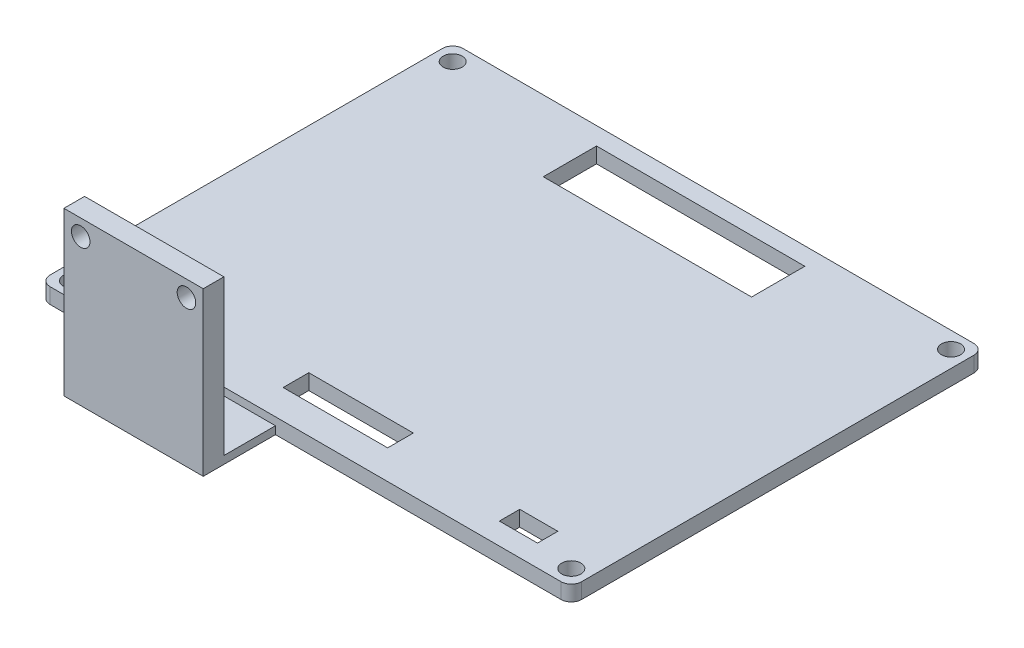
from build123d import *

# Parameters (mm, degrees)
SKETCH_1_R          = 1.85
SKETCH_1_W          = 7.387531562
SKETCH_1_H          = 3.94976935
SKETCH_1_W_2        = 20.26085389
SKETCH_1_H_2        = 4.973783626
SKETCH_1_W_3        = 40.374860346
SKETCH_1_H_3        = 10.321291022
EXTRUDE_1_DEPTH     = 3
SKETCH_2_W          = 27
SKETCH_2_H          = 1.5
EXTRUDE_2_DEPTH     = 14
SKETCH_4_W          = 27
SKETCH_4_H          = 4
EXTRUDE_3_DEPTH     = 30
SKETCH_5_R          = 1.8
CUT_EXTRUDE_1_DEPTH = 30


with BuildPart() as part:
    # 草图1 → 凸台-拉伸1 (new body)
    with BuildSketch(Plane(origin=(0, 0, 0), x_dir=(1, 0, 0), z_dir=(0, 1, 0))):
        with BuildLine():
            Line((-49.5, -40), (49.5, -40))
            ThreePointArc((49.5, -40), (50.914213562, -39.414213562), (51.5, -38))
            Line((51.5, -38), (51.5, 38))
            ThreePointArc((51.5, 38), (50.914213562, 39.414213562), (49.5, 40))
            Line((49.5, 40), (-49.5, 40))
            ThreePointArc((-49.5, 40), (-50.914213562, 39.414213562), (-51.5, 38))
            Line((-51.5, 38), (-51.5, -38))
            ThreePointArc((-51.5, -38), (-50.914213562, -39.414213562), (-49.5, -40))
        make_face()
        with Locations((-48.296806281, -36.796806281)):
            Circle(SKETCH_1_R, mode=Mode.SUBTRACT)
        with Locations((-37.047373629, -33.829043047)):
            Rectangle(SKETCH_1_W, SKETCH_1_H, mode=Mode.SUBTRACT)
        with Locations((0.109715815, -31.854158372)):
            Rectangle(SKETCH_1_W_2, SKETCH_1_H_2, mode=Mode.SUBTRACT)
        with Locations((37.047373629, -33.829043047)):
            Rectangle(SKETCH_1_W, SKETCH_1_H, mode=Mode.SUBTRACT)
        with Locations((48.296806281, -36.796806281)):
            Circle(SKETCH_1_R, mode=Mode.SUBTRACT)
        with Locations((48.296806281, 36.796806281)):
            Circle(SKETCH_1_R, mode=Mode.SUBTRACT)
        with Locations((-48.296806281, 36.796806281)):
            Circle(SKETCH_1_R, mode=Mode.SUBTRACT)
        with Locations((0, 31.409786363)):
            Rectangle(SKETCH_1_W_3, SKETCH_1_H_3, mode=Mode.SUBTRACT)
    extrude(amount=EXTRUDE_1_DEPTH)

    # 草图2 → 凸台-拉伸2 (add)
    with BuildSketch(Plane.XY.offset(40)):
        with Locations((-19.346509013, 0.75)):
            Rectangle(SKETCH_2_W, SKETCH_2_H)
    extrude(amount=EXTRUDE_2_DEPTH)

    # 草图4 → 凸台-拉伸3 (add)
    with BuildSketch(Plane(origin=(0, 1.5, 0), x_dir=(1, 0, 0), z_dir=(0, 1, 0))):
        with Locations((-19.346509013, -52)):
            Rectangle(SKETCH_4_W, SKETCH_4_H)
    extrude(amount=EXTRUDE_3_DEPTH)

    # 草图5 → 切除-拉伸1 (cut)
    with BuildSketch(Plane.XY.offset(54)):
        with Locations((-29.596509013, 28.381274353)):
            Circle(SKETCH_5_R)
        with Locations((-9.096509013, 28.381274353)):
            Circle(SKETCH_5_R)
    extrude(amount=-CUT_EXTRUDE_1_DEPTH, mode=Mode.SUBTRACT)


solid = part.part
